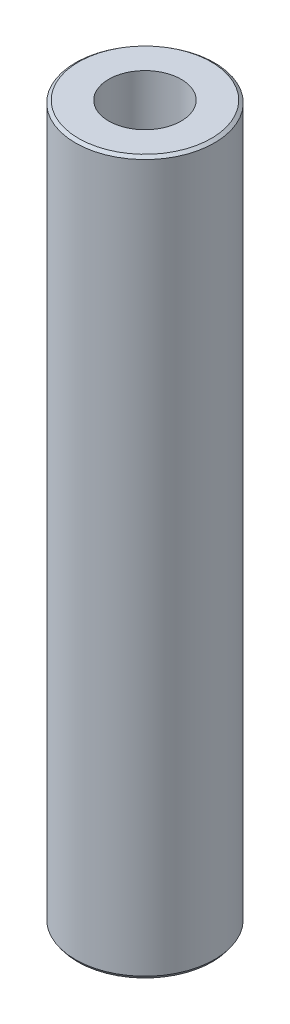
from build123d import *
from OCP.BRepFilletAPI import BRepFilletAPI_MakeChamfer

# Parameters (mm, degrees)
SKETCH1_R           = 12.5
BOSS_EXTRUDE1_DEPTH = 128.16990043
SKETCH2_R           = 6.518319148
CUT_EXTRUDE1_DEPTH  = 130.383242254
CHAMFER1_SIZE       = 0.41723884
CHAMFER1_SIZE2      = 0.571530755


with BuildPart() as part:
    # Sketch1 → Boss-Extrude1 (new body)
    with BuildSketch(Plane(origin=(0, 0, 0), x_dir=(1, 0, 0), z_dir=(0, 1, 0))):
        Circle(SKETCH1_R)
    extrude(amount=BOSS_EXTRUDE1_DEPTH)

    # Sketch2 → Cut-Extrude1 (cut, through all)
    with BuildSketch(Plane(origin=(0, 0, 0), x_dir=(1, 0, 0), z_dir=(0, 1, 0))):
        Circle(SKETCH2_R)
    extrude(amount=CUT_EXTRUDE1_DEPTH, mode=Mode.SUBTRACT)

    # Chamfer1: one chamfer whose edges measure the first distance from different faces: ONE call of the kernel's chamfer builder (chamfer() names one face for all edges)
    chamfer1_edges_1 = [part.edges().sort_by_distance(p)[0] for p in [
        (-12.5, 128.16990043, 0),
    ]]
    chamfer1_side_1 = [part.faces().sort_by_distance(p)[0] for p in [
        (-12.5, 64.084950215, 0),
    ]]
    chamfer1_edges_2 = [part.edges().sort_by_distance(p)[0] for p in [
        (-12.5, 0, 0),
    ]]
    chamfer1_side_2 = [part.faces().sort_by_distance(p)[0] for p in [
        (-12.146446609, 0, 0),
    ]]
    chamfer1 = BRepFilletAPI_MakeChamfer(part.part.solid().wrapped)
    for e in chamfer1_edges_1:
        chamfer1.Add(CHAMFER1_SIZE, CHAMFER1_SIZE2, e.wrapped, chamfer1_side_1[0].wrapped)  # the first distance lies on this face
    for e in chamfer1_edges_2:
        chamfer1.Add(CHAMFER1_SIZE, CHAMFER1_SIZE2, e.wrapped, chamfer1_side_2[0].wrapped)  # the first distance lies on this face
    add(Compound.cast(chamfer1.Shape()), mode=Mode.REPLACE)


solid = part.part
